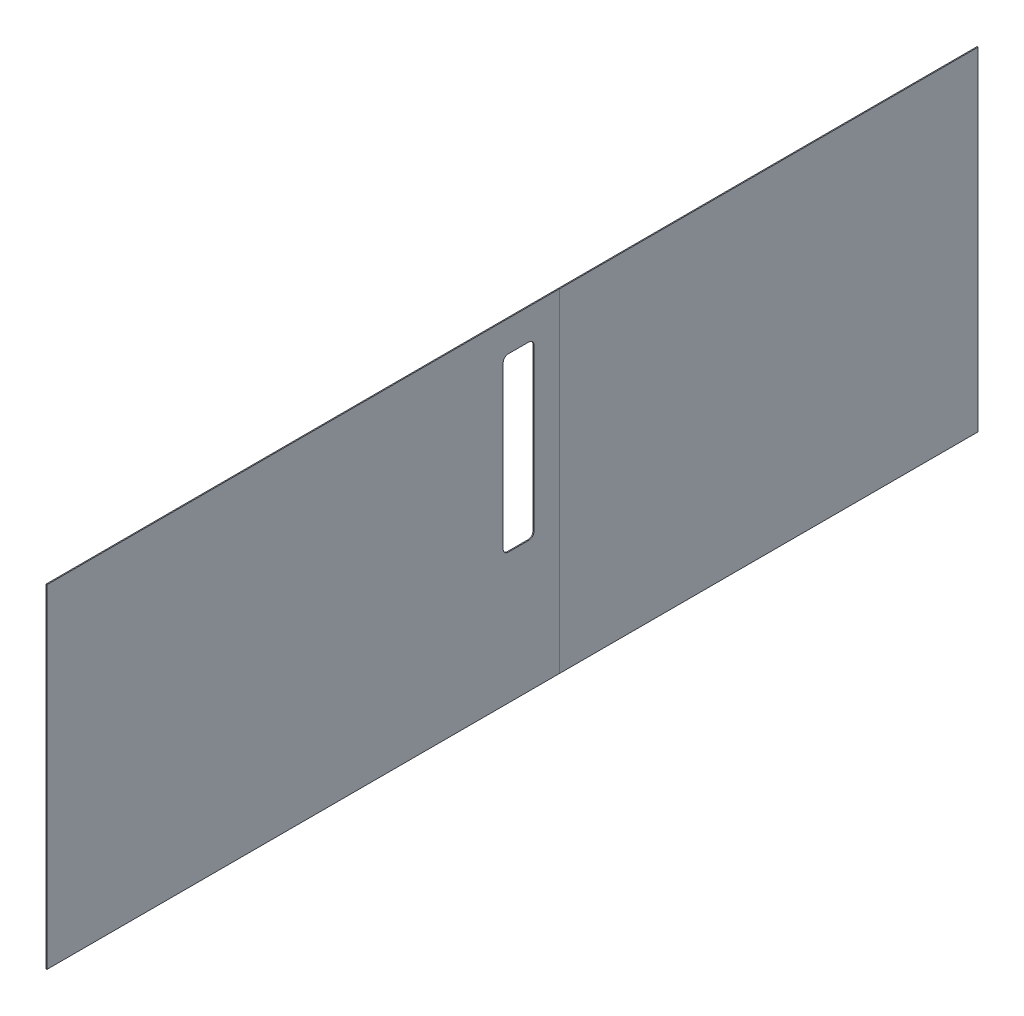
from build123d import *

# Parameters (mm, degrees)
BRIDA_BASE2_DEPTH          = 650
CORTAR_EXTRUIR1_DEPTH      = 1198.031165008
CORTAR_EXTRUIR1_DEPTH_BACK = 1198.031165008
DESDOBLAR1_DEPTH           = 650
DESDOBLAR1_2_DEPTH         = 650


# Read off the part's stored shape, not the designer's step: Desdoblar1
# Sheet-metal steps are written as plain solids
with BuildPart() as part:
    # Croquis1 → Brida base2 (new body)
    with BuildSketch(Plane(origin=(0, 0, 0), x_dir=(1, 0, 0), z_dir=(0, 1, 0))):
        with BuildLine():
            Line((0, -1000), (0, -0.045297188))
            ThreePointArc((0, -0.045297188), (0.001388837, -8.5406e-05), (0.005550109, 0.044955885))
            Line((0.005550109, 0.044955885), (100, 810))
            Line((100, 810), (98.114316057, 810.232800487))
            Line((98.114316057, 810.232800487), (-1.880133834, 0.277756371))
            ThreePointArc((-1.880133834, 0.277756371), (-1.895028772, 0.116534721), (-1.9, -0.045297188))
            Line((-1.9, -0.045297188), (-1.9, -1000))
            Line((-1.9, -1000), (0, -1000))
        make_face()
    extrude(amount=BRIDA_BASE2_DEPTH)

    # Croquis11 → Cortar-Extruir1 (cut, two sides: drawn at the far end of the back side and taken through both)
    with BuildSketch(Plane.ZY.offset(1.9).offset(-CORTAR_EXTRUIR1_DEPTH_BACK)):
        with BuildLine():
            Line((60, 590), (100, 590))
            ThreePointArc((100, 590), (107.071067812, 587.071067812), (110, 580))
            Line((110, 580), (110, 265))
            ThreePointArc((110, 265), (107.071067812, 257.928932188), (100, 255))
            Line((100, 255), (60, 255))
            ThreePointArc((60, 255), (52.928932188, 257.928932188), (50, 265))
            Line((50, 265), (50, 580))
            ThreePointArc((50, 580), (52.928932188, 587.071067812), (60, 590))
        make_face()
    extrude(amount=CORTAR_EXTRUIR1_DEPTH + CORTAR_EXTRUIR1_DEPTH_BACK, mode=Mode.SUBTRACT)

    # Desdoblar1 outline → Desdoblar1 (cut)
    with BuildSketch(Plane(origin=(0, 0, 0), x_dir=(1, 0, 0), z_dir=(0, 1, 0))):
        with BuildLine():
            Line((98.114316057, 810.232800487), (0, 15.506840426))
            Line((0, 15.506840426), (0, -0.045297188))
            ThreePointArc((0, -0.045297188), (0.001388837, -8.5406e-05), (0.005550109, 0.044955885))
            Line((0.005550109, 0.044955885), (100, 810))
            Line((100, 810), (98.114316057, 810.232800487))
        make_face()
    extrude(amount=DESDOBLAR1_DEPTH, mode=Mode.SUBTRACT)

    # Desdoblar1 2 outline → Desdoblar1 2 (add)
    with BuildSketch(Plane(origin=(0, 0, 0), x_dir=(1, 0, 0), z_dir=(0, 1, 0))):
        with BuildLine():
            Line((0, 15.506840426), (0, 816.266075647))
            Line((0, 816.266075647), (-1.9, 816.266075647))
            Line((-1.9, 816.266075647), (-1.9, -0.045297188))
            ThreePointArc((-1.9, -0.045297188), (-1.895028772, 0.116534721), (-1.880133834, 0.277756371))
            Line((-1.880133834, 0.277756371), (0, 15.506840426))
        make_face()
    extrude(amount=DESDOBLAR1_2_DEPTH)


solid = part.part
